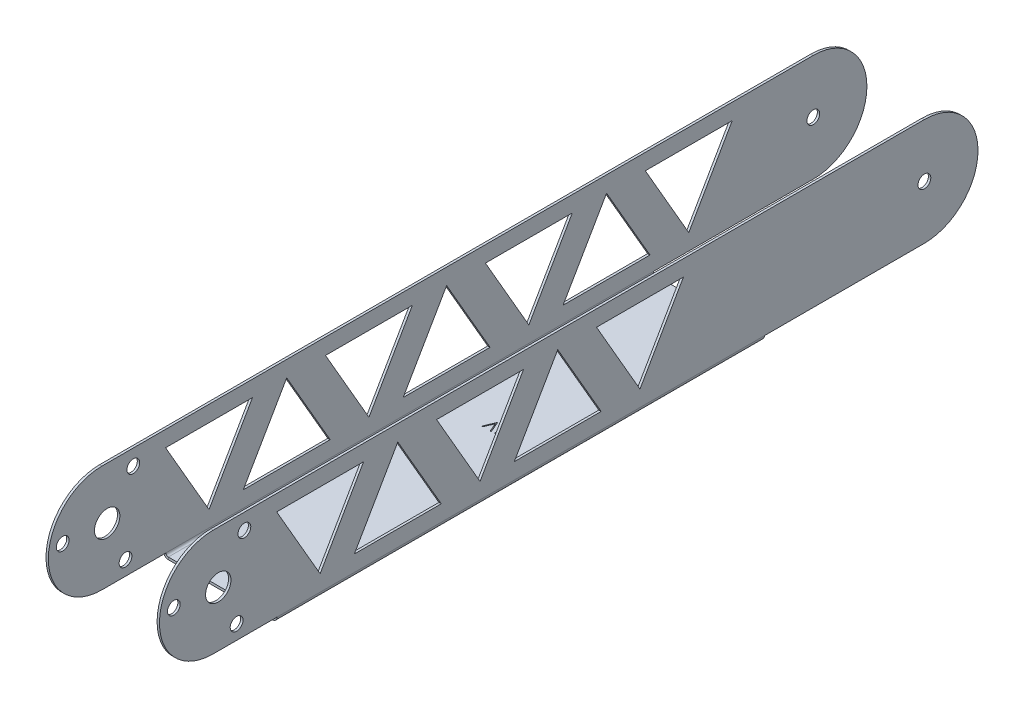
from build123d import *

# Parameters (mm, degrees)
SKETCH1_W                         = 32
SKETCH1_H                         = 152.4
BASE_FLANGE1_DEPTH                = 0.7366
EDGE_FLANGE1_DEPTH                = 152.4
EDGE_FLANGE1_BEND_DEPTH           = 152.4
SKETCH13_R                        = 2
TAB1_DEPTH                        = 0.7366
SKETCH21_R                        = 2
TAB2_DEPTH                        = 0.7366
CUT_EXTRUDE5_DEPTH                = 378.459903207
CUT_EXTRUDE5_DEPTH_BACK           = 378.459903207
SKETCH27_R                        = 3.96875
CUT_EXTRUDE6_DEPTH                = 152.231154983
CUT_EXTRUDE9_DEPTH                = 5
CUT_EXTRUDE10_DEPTH               = 5
SKETCH42_W                        = 2
SKETCH42_H                        = 35.4732
F_4_0_4_DIAMETER_HOLE1_AT_2_COUNT = 2
F_4_0_4_DIAMETER_HOLE1_AT_2_PITCH = 24.194584718
F_4_0_4_DIAMETER_HOLE1_AT_3_COUNT = 2
F_4_0_4_DIAMETER_HOLE1_AT_3_PITCH = 24.194584718


# Sheet-metal steps are written as plain solids
with BuildPart() as part:
    # Sketch1 → Base-Flange1 (new body)
    with BuildSketch(Plane(origin=(0, 0, 0), x_dir=(1, 0, 0), z_dir=(0, 1, 0))):
        Rectangle(SKETCH1_W, SKETCH1_H)
    extrude(amount=-BASE_FLANGE1_DEPTH)

    # Edge-Flange1 section (across the edge) → Edge-Flange1 (add)
    with BuildSketch(Plane(origin=(17, 0, 76.2), x_dir=(-1, 0, 0), z_dir=(0, 0, -1))):
        with BuildLine():
            Line((-0.7366, 0.7366), (-0.7366, 34.2634))
            Line((-0.7366, 34.2634), (0, 34.2634))
            Line((0, 34.2634), (0, 0.7366))
            ThreePointArc((0, 0.7366), (0.215745145, 0.215745145), (0.7366, 0))
            Line((0.7366, 0), (1, 0))
            Line((1, 0), (1, -0.7366))
            Line((1, -0.7366), (0.7366, -0.7366))
            ThreePointArc((0.7366, -0.7366), (-0.30510971, -0.30510971), (-0.7366, 0.7366))
        make_face()
    extrude(amount=EDGE_FLANGE1_DEPTH)

    # Edge-Flange1 section 2 (across the edge) → Edge-Flange1 bend (add)
    with BuildSketch(Plane(origin=(-17, 0, -76.2), x_dir=(1, 0, 0), z_dir=(0, 0, 1))):
        with BuildLine():
            Line((-0.7366, 0.7366), (-0.7366, 34.2634))
            Line((-0.7366, 34.2634), (0, 34.2634))
            Line((0, 34.2634), (0, 0.7366))
            ThreePointArc((0, 0.7366), (0.215745145, 0.215745145), (0.7366, 0))
            Line((0.7366, 0), (1, 0))
            Line((1, 0), (1, -0.7366))
            Line((1, -0.7366), (0.7366, -0.7366))
            ThreePointArc((0.7366, -0.7366), (-0.30510971, -0.30510971), (-0.7366, 0.7366))
        make_face()
    extrude(amount=EDGE_FLANGE1_BEND_DEPTH)

    # Sketch13 → Tab1 (add)
    with BuildSketch(Plane(origin=(17.7366, 0, 0), x_dir=(0, 0, -1), z_dir=(1, 0, 0))):
        with BuildLine():
            Line((76.2, 0.7366), (76.2, 34.2634))
            Line((76.2, 34.2634), (126.2, 34.2634))
            ThreePointArc((126.2, 34.2634), (142.9634, 17.5), (126.2, 0.7366))
            Line((126.2, 0.7366), (76.2, 0.7366))
        make_face()
        with Locations(Location((126.2, 17.5, 0), (0, 0, 90))):
            Circle(SKETCH13_R, mode=Mode.SUBTRACT)
    tab1 = extrude(amount=-TAB1_DEPTH)

    # Mirror1: Tab1 across plane
    add(tab1.mirror(Plane(origin=(0, 0, 0), x_dir=(0, 0, 1), z_dir=(1, 0, 0))))

    # Sketch21 → Tab2 (add)
    with BuildSketch(Plane.ZY.offset(17.7366)):
        with BuildLine():
            Line((76.2, 0.7366), (76.2, 34.2634))
            Line((76.2, 34.2634), (96.2, 34.2634))
            ThreePointArc((96.2, 34.2634), (112.9634, 17.5), (96.2, 0.7366))
            Line((96.2, 0.7366), (76.2, 0.7366))
        make_face()
        with Locations(Location((96.2, 17.5, 0), (0, 0, 270))):
            Circle(SKETCH21_R, mode=Mode.SUBTRACT)
    tab2 = extrude(amount=-TAB2_DEPTH)

    # Mirror2: Tab2 across plane
    add(tab2.mirror(Plane(origin=(0, 0, 0), x_dir=(0, 0, 1), z_dir=(1, 0, 0))))

    # Sketch27 → Cut-Extrude5 (cut, two sides: drawn at the far end of the back side and taken through both)
    with BuildSketch(Plane(origin=(-1.8, 181.68919546, 186.907982421), x_dir=(6.7392179279257654e-15, -0.7462813550386803, 0.6656306326496935), z_dir=(1, 0, 0)).offset(-CUT_EXTRUDE5_DEPTH_BACK)):
        with Locations(Location((60.717966786, 177.878571709, 0), (0, 0, 221.730724012))):
            Circle(SKETCH27_R)
    extrude(amount=CUT_EXTRUDE5_DEPTH + CUT_EXTRUDE5_DEPTH_BACK, mode=Mode.SUBTRACT)

    # Sketch28 → Cut-Extrude6 (cut, through all)
    with BuildSketch(Plane.ZY.offset(17.7366)):
        Polygon((76.313906493, 29.2634), (49.147497867, 29.2634), (62.73070218, 5.7366), align=None)
        Polygon((52.02060197, 5.7366), (38.437397657, 29.2634), (24.854193344, 5.7366), align=None)
        Polygon((26.313906493, 29.2634), (-0.852502133, 29.2634), (12.73070218, 5.7366), align=None)
        Polygon((2.02060197, 5.7366), (-11.562602343, 29.2634), (-25.145806656, 5.7366), align=None)
        Polygon((-23.686093507, 29.2634), (-50.852502133, 29.2634), (-37.26929782, 5.7366), align=None)
    extrude(amount=-CUT_EXTRUDE6_DEPTH, mode=Mode.SUBTRACT)

    # Sketch34 → Cut-Extrude9 (cut)
    with BuildSketch(Plane.ZY.offset(17.7366)):
        Polygon((-47.97939803, 5.7366), (-75.145806656, 5.7366), (-61.562602343, 29.2634), align=None)
        Polygon((-73.686093507, 29.2634), (-100.852502133, 29.2634), (-87.26929782, 5.7366), align=None)
    extrude(amount=-CUT_EXTRUDE9_DEPTH, mode=Mode.SUBTRACT)

    # Sketch36 → Cut-Extrude10 (cut)
    # profile 1 of 4: a face of its own
    with BuildSketch(Plane.XZ.offset(0.7366)):
        Polygon((-2.7193999, -8.2157924), (-2.382861438, -8.2157924), (-1.216194772, -10.974005541), (-0.049528105, -8.2157924), (0.287010356, -8.2157924), (-1.193758874, -11.7157924), (-1.238630669, -11.7157924), align=None)
    # profile 2 of 4: a face of its own
    with BuildSketch(Plane.XZ.offset(0.7366)):
        Polygon((1.345003145, -8.2157924), (1.992138562, -8.2157924), (1.992138562, -11.7157924), (1.678035997, -11.7157924), (1.678035997, -8.574766759), (1.139574459, -8.574766759), align=None)
    # profile 3 of 4: a face of its own
    with BuildSketch(Plane.XZ.offset(0.7366)):
        with BuildLine():
            add(Edge.make_bspline(
                [(3.854318049, -11.177330861), (3.873808261, -11.178489028), (3.912016543, -11.180759478), (3.967255672, -11.196336152), (4.017250331, -11.223994813), (4.061782576, -11.260857591), (4.098489053, -11.305553254), (4.127133405, -11.355149163), (4.14257439, -11.410850755), (4.144828302, -11.44928043), (4.145984715, -11.468997528)],
                knots=[0, 0, 0, 0, 1.020151414, 1.999887582, 2.974338812, 3.990962822, 5.007586832, 5.987933904, 6.967670073, 8, 8, 8, 8], degree=3))
            add(Edge.make_bspline(
                [(4.145984715, -11.468997528), (4.144789115, -11.488240858), (4.142431408, -11.526188421), (4.127168799, -11.581469884), (4.098270749, -11.631096789), (4.062035756, -11.676398927), (4.017239323, -11.713339797), (3.967137476, -11.740763142), (3.912146218, -11.757455122), (3.873829895, -11.759581419), (3.854318049, -11.760664195)],
                knots=[0, 0, 0, 0, 1.009421747, 1.99056486, 2.972319754, 3.999869655, 5.017953583, 5.993804169, 6.978383603, 8, 8, 8, 8], degree=3))
            add(Edge.make_bspline(
                [(3.854318049, -11.760664195), (3.834792143, -11.759620597), (3.79667246, -11.757583222), (3.741886466, -11.740420416), (3.691479498, -11.713596956), (3.646691786, -11.676330046), (3.610153314, -11.631329903), (3.582527931, -11.581128107), (3.565937782, -11.526346669), (3.56375591, -11.488272026), (3.562651382, -11.468997528)],
                knots=[0, 0, 0, 0, 1.022052826, 1.995314843, 2.982371812, 4.00089066, 5.028879526, 6.005146991, 6.990147033, 8, 8, 8, 8], degree=3))
            add(Edge.make_bspline(
                [(3.562651382, -11.468997528), (3.563713481, -11.449248148), (3.5657871, -11.410689908), (3.58256276, -11.355490801), (3.609938972, -11.305322362), (3.646944367, -11.260925781), (3.691468663, -11.223738479), (3.741764868, -11.196673686), (3.796804408, -11.180633273), (3.834814347, -11.178450757), (3.854318049, -11.177330861)],
                knots=[0, 0, 0, 0, 1.032775665, 2.016367738, 2.991239715, 4.008302682, 5.025365648, 6.011011707, 6.979408107, 8, 8, 8, 8], degree=3))
        make_face()
    # profile 4 of 4: a face of its own
    with BuildSketch(Plane.XZ.offset(0.7366)):
        with BuildLine():
            add(Edge.make_bspline(
                [(4.594702664, -9.967194643), (4.595030682, -9.911097256), (4.595667862, -9.802127271), (4.602756283, -9.643342629), (4.614531625, -9.49438234), (4.630668998, -9.355239274), (4.650306979, -9.22587751), (4.676522465, -9.106642753), (4.706335268, -8.996983146), (4.740887714, -8.896541098), (4.779875503, -8.803963395), (4.822309763, -8.717538193), (4.869874558, -8.637396261), (4.919851471, -8.56225847), (4.974263542, -8.493354776), (5.031562333, -8.429712113), (5.093984209, -8.372801363), (5.159407217, -8.32095506), (5.228423682, -8.275505589), (5.299066348, -8.23547285), (5.371821454, -8.201272983), (5.446887637, -8.174382547), (5.523590194, -8.1521717), (5.602197261, -8.136982752), (5.682838625, -8.127425844), (5.73727006, -8.126512176), (5.76487494, -8.12604881)],
                knots=[0, 0, 0, 0, 1.646270934, 3.197905019, 4.663502075, 6.030701355, 7.308322542, 8.50163776, 9.611534131, 10.641858119, 11.616356847, 12.558055219, 13.465016945, 14.349605745, 15.204443733, 16.039544428, 16.859896111, 17.680448484, 18.487036065, 19.28249412, 20.06191084, 20.843045899, 21.620316918, 22.403196591, 23.190181807, 24, 24, 24, 24], degree=3))
            add(Edge.make_bspline(
                [(5.76487494, -8.12604881), (5.792710418, -8.126536625), (5.848066427, -8.127506736), (5.929906802, -8.136830679), (6.009856484, -8.152301802), (6.087574623, -8.174222776), (6.163699609, -8.201418453), (6.237636017, -8.23550557), (6.309843099, -8.275184437), (6.379173386, -8.321808315), (6.446388001, -8.373790591), (6.509835964, -8.43255326), (6.56952305, -8.497502979), (6.626198356, -8.567944843), (6.678253953, -8.645229928), (6.727827385, -8.728014038), (6.772199421, -8.817744902), (6.814934096, -8.91292537), (6.851821083, -9.016189029), (6.885087328, -9.12695379), (6.911966297, -9.246527976), (6.934355569, -9.374284222), (6.951700465, -9.510691705), (6.964333107, -9.65545802), (6.971006192, -9.808678411), (6.972262893, -9.91343626), (6.972907792, -9.967194643)],
                knots=[0, 0, 0, 0, 0.810914788, 1.612654377, 2.396697861, 3.181598691, 3.963628158, 4.749916497, 5.551656086, 6.361998678, 7.18212741, 8.025565596, 8.878627764, 9.750805457, 10.657531673, 11.591944965, 12.560506719, 13.57287815, 14.630710178, 15.753379473, 16.941251878, 18.199788006, 19.531962791, 20.947069417, 22.433333509, 24, 24, 24, 24], degree=3))
            add(Edge.make_bspline(
                [(6.972907792, -9.967194643), (6.972256208, -10.020718551), (6.970986622, -10.125007703), (6.964407915, -10.277538678), (6.951449284, -10.421536722), (6.935239296, -10.557347184), (6.912788333, -10.684404803), (6.885183166, -10.803149252), (6.854532844, -10.914093323), (6.816698049, -11.016328135), (6.775287339, -11.111279858), (6.730232143, -11.199947006), (6.681962317, -11.283113299), (6.629373572, -11.360113046), (6.573320159, -11.431491703), (6.51260237, -11.495989325), (6.448931785, -11.555159997), (6.381519369, -11.607811625), (6.311107818, -11.653896429), (6.239148741, -11.69511028), (6.164365357, -11.728342975), (6.088452405, -11.756878016), (6.010324039, -11.778678468), (5.930077648, -11.793752323), (5.848121412, -11.804324172), (5.792719847, -11.805130652), (5.76487494, -11.80553599)],
                knots=[0, 0, 0, 0, 1.561518951, 3.042555995, 4.452378317, 5.7783523, 7.031515105, 8.214008947, 9.334062868, 10.386615937, 11.391082383, 12.354592575, 13.286541444, 14.194233754, 15.072674879, 15.931287219, 16.775624067, 17.606195743, 18.42308326, 19.229000347, 20.022332153, 20.807536673, 21.593273796, 22.3848459, 23.188221202, 24, 24, 24, 24], degree=3))
            add(Edge.make_bspline(
                [(5.76487494, -11.80553599), (5.737270826, -11.805069634), (5.682840901, -11.804150072), (5.602188476, -11.794636341), (5.523906032, -11.779340837), (5.447607278, -11.757924233), (5.372900763, -11.731709397), (5.300804476, -11.697555713), (5.230516793, -11.658221644), (5.162225237, -11.613426223), (5.097213076, -11.56210454), (5.03511447, -11.505340251), (4.977489451, -11.44171684), (4.923855356, -11.372238917), (4.872881267, -11.297545674), (4.825991894, -11.216617301), (4.78262104, -11.129774691), (4.742977549, -11.03645678), (4.707828886, -10.935301852), (4.676781178, -10.825152674), (4.65226702, -10.705037038), (4.631284065, -10.575919671), (4.614359682, -10.43724574), (4.602805356, -10.288939962), (4.595664041, -10.131094753), (4.595028971, -10.022824979), (4.594702664, -9.967194643)],
                knots=[0, 0, 0, 0, 0.810891512, 1.598919785, 2.382837074, 3.152667961, 3.926044502, 4.706494248, 5.493654104, 6.291793342, 7.103789334, 7.925228297, 8.761435821, 9.622817696, 10.50288917, 11.416980706, 12.369136599, 13.353924996, 14.394355917, 15.514179734, 16.714354668, 17.994756427, 19.357759367, 20.818452758, 22.365282078, 24, 24, 24, 24], degree=3))
        make_face()
        with BuildLine():
            add(Edge.make_bspline(
                [(4.908805228, -9.9657924), (4.908924675, -10.012541099), (4.909156499, -10.103271143), (4.915212699, -10.235114404), (4.923462931, -10.358084733), (4.934104228, -10.47233827), (4.949907177, -10.577488282), (4.967613965, -10.674257965), (4.989162054, -10.762135202), (5.014657072, -10.841723013), (5.043696169, -10.914372082), (5.075402033, -10.981973297), (5.109462756, -11.045325233), (5.147581906, -11.103858841), (5.189096969, -11.157765006), (5.233070229, -11.207997838), (5.281142813, -11.252794819), (5.347646555, -11.306521674), (5.43544303, -11.362040808), (5.546063485, -11.410386898), (5.659731936, -11.440769354), (5.736883186, -11.44463311), (5.775391767, -11.446561631)],
                knots=[0, 0, 0, 0, 1.459021318, 2.831673884, 4.118529203, 5.306027144, 6.411944654, 7.436330062, 8.375795394, 9.233974572, 10.042671642, 10.816086306, 11.563610507, 12.285937304, 12.993564865, 13.685989202, 14.367179055, 15.041617293, 16.353048772, 17.594441528, 18.799311195, 20, 20, 20, 20], degree=3))
            add(Edge.make_bspline(
                [(5.775391767, -11.446561631), (5.814149438, -11.44496385), (5.891584761, -11.441771587), (6.004718557, -11.41097285), (6.114548827, -11.36450331), (6.200620767, -11.309555805), (6.26610331, -11.257227475), (6.313020301, -11.212612827), (6.356082349, -11.16265696), (6.396924424, -11.108757664), (6.4343835, -11.04988518), (6.468446637, -10.986322604), (6.499529985, -10.917893426), (6.517239031, -10.870123687), (6.526293209, -10.845700252)],
                knots=[0, 0, 0, 0, 1.353760809, 2.704726607, 4.075137775, 5.516104923, 6.260822281, 7.007110065, 7.778089737, 8.566572457, 9.372053459, 10.217411131, 11.088608312, 12, 12, 12, 12], degree=3))
            add(Edge.make_bspline(
                [(6.526293209, -10.845700252), (6.536844977, -10.814470513), (6.558269591, -10.751060749), (6.585881365, -10.652697097), (6.607626764, -10.549494333), (6.62719013, -10.442069216), (6.640543186, -10.329629515), (6.651290999, -10.212523131), (6.657621686, -10.090661769), (6.658406437, -10.007866778), (6.658805228, -9.9657924)],
                knots=[0, 0, 0, 0, 0.884706709, 1.796334032, 2.740027952, 3.714592787, 4.726048262, 5.777819803, 6.87074269, 8, 8, 8, 8], degree=3))
            add(Edge.make_bspline(
                [(6.658805228, -9.9657924), (6.658255039, -9.923724827), (6.657178751, -9.841431662), (6.653064763, -9.720913482), (6.642441189, -9.606445721), (6.63064207, -9.497535248), (6.613244849, -9.394784946), (6.594487042, -9.29733464), (6.56928583, -9.206391615), (6.542366055, -9.120532034), (6.511555659, -9.040731379), (6.477639925, -8.966617593), (6.441418166, -8.897832868), (6.402075926, -8.834565927), (6.360080243, -8.776533384), (6.314322694, -8.724898789), (6.266618321, -8.678061821), (6.199801135, -8.624599252), (6.112326845, -8.570087556), (6.003481198, -8.519921797), (5.890210554, -8.491113504), (5.813637099, -8.487051817), (5.775391767, -8.485023169)],
                knots=[0, 0, 0, 0, 1.31362396, 2.569729283, 3.763502607, 4.902122613, 5.988968491, 7.01645872, 7.998833611, 8.933434873, 9.825090667, 10.667526885, 11.477055099, 12.250526234, 12.991942729, 13.710640831, 14.402115721, 15.076753259, 16.378508321, 17.609869233, 18.806226677, 20, 20, 20, 20], degree=3))
            add(Edge.make_bspline(
                [(5.775391767, -8.485023169), (5.736681175, -8.487054616), (5.659189469, -8.49112121), (5.544741514, -8.519814463), (5.435037163, -8.569827429), (5.347794188, -8.624779802), (5.280930401, -8.677118113), (5.233847708, -8.722504567), (5.189701536, -8.772150822), (5.149033836, -8.826552736), (5.110944552, -8.885018104), (5.07596354, -8.948006869), (5.04444621, -9.015838233), (5.015361674, -9.088454668), (4.989788886, -9.168035613), (4.968694923, -9.255804606), (4.94920787, -9.352266498), (4.935412601, -9.457986006), (4.923148845, -9.572268159), (4.915267497, -9.695545478), (4.90913624, -9.827609858), (4.908917775, -9.918809016), (4.908805228, -9.9657924)],
                knots=[0, 0, 0, 0, 1.207732386, 2.417664972, 3.655092373, 4.956220595, 5.625982001, 6.301752483, 6.994047911, 7.697131622, 8.419323945, 9.170223765, 9.943494443, 10.752040957, 11.610060368, 12.549350801, 13.567764191, 14.679664412, 15.874934091, 17.154273443, 18.533957287, 20, 20, 20, 20], degree=3))
        make_face(mode=Mode.SUBTRACT)
    extrude(amount=-CUT_EXTRUDE10_DEPTH, mode=Mode.SUBTRACT)


with BuildPart() as cut_extrude10_piece_1:
    # of the separate pieces the step leaves, piece 1, a body of its own (cut_extrude10_pieces)
    add(part.part.solids().sort_by_distance((16.2634, -0.7366, -76.2))[0])

    # Sketch42 → Ø4.0 (4) Diameter Hole1 (revolve, cut)
    with BuildSketch(Plane(origin=(-17.7366, 5.238185548, 88.840631654), x_dir=(0, 0, 1), z_dir=(0, 1, 0))):
        with Locations((1, 17.7366)):
            Rectangle(SKETCH42_W, SKETCH42_H)
    f_4_0_4_diameter_hole1 = revolve(axis=Axis((-24.0866, 5.238185548, 88.840631654), (1, 0, 0)), mode=Mode.SUBTRACT)

    # Ø4.0 (4) Diameter Hole1 at 2: Ø4.0 (4) Diameter Hole1 ×2
    with Locations(*[Vector(-3.4140116061483288e-15, 0.9949559159265327, -0.10031313654150449) * (i * F_4_0_4_DIAMETER_HOLE1_AT_2_PITCH) for i in range(1, F_4_0_4_DIAMETER_HOLE1_AT_2_COUNT)]):
        add(f_4_0_4_diameter_hole1, mode=Mode.SUBTRACT)

    # Ø4.0 (4) Diameter Hole1 at 3: Ø4.0 (4) Diameter Hole1 ×2
    with Locations(*[Vector(-1.9089097152657236e-15, 0.5843516825414501, 0.8115005305672797) * (i * F_4_0_4_DIAMETER_HOLE1_AT_3_PITCH) for i in range(1, F_4_0_4_DIAMETER_HOLE1_AT_3_COUNT)]):
        add(f_4_0_4_diameter_hole1, mode=Mode.SUBTRACT)


with BuildPart() as cut_extrude10_piece_2:
    # of the separate pieces the step leaves, piece 2, a body of its own (cut_extrude10_pieces)
    add(part.part.solids().sort_by_distance((5.775391767, -0.7366, -8.485023169))[0])


solid = Compound([cut_extrude10_piece_1.part, cut_extrude10_piece_2.part])
